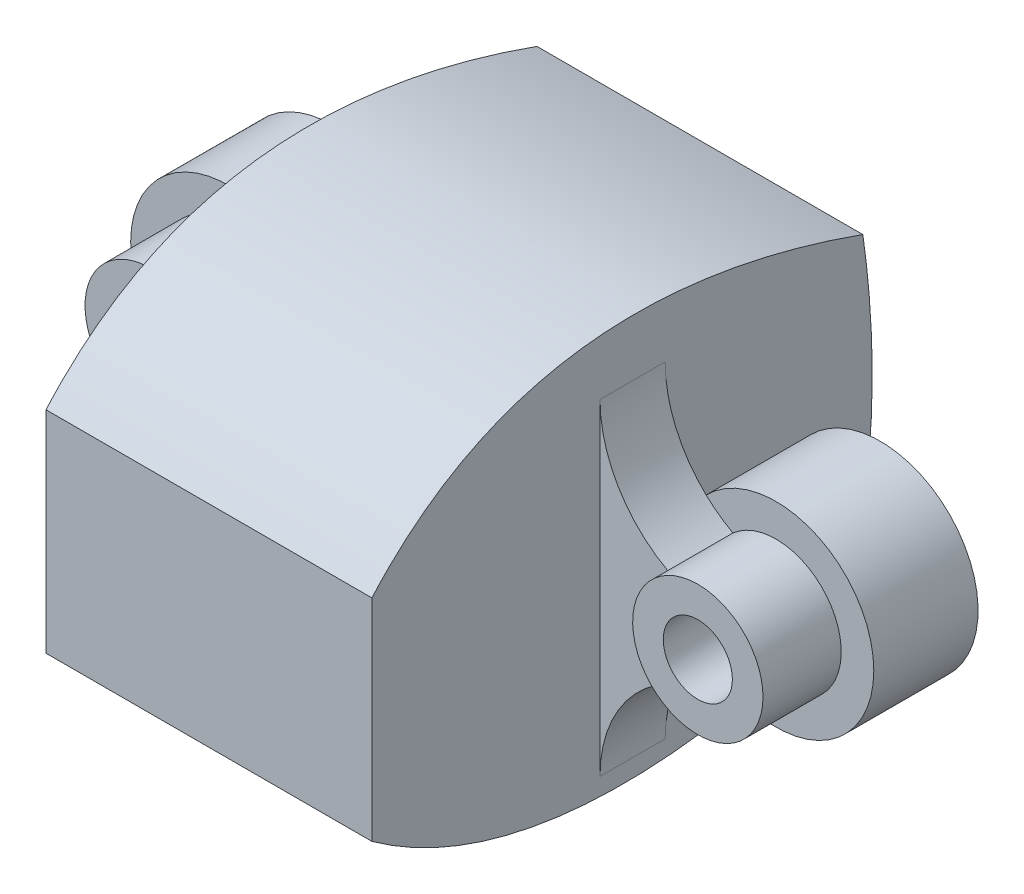
from build123d import *

# Parameters (mm, degrees)
BOSS_EXTRUDE1_DEPTH = 12.5
SKETCH3_W           = 5
SKETCH3_H           = 7.5
BOSS_EXTRUDE2_DEPTH = 27.5
SKETCH4_R           = 7.5
BOSS_EXTRUDE3_DEPTH = 8
SKETCH5_W           = 10.105162594
SKETCH5_H           = 17.406531809
CUT_EXTRUDE1_DEPTH  = 151.624338723
SKETCH6_R           = 5
BOSS_EXTRUDE4_DEPTH = 6
FILLET1_R           = 10
SKETCH7_R           = 2.65
CUT_EXTRUDE2_DEPTH  = 6


with BuildPart() as part:
    # Sketch1 → Boss-Extrude1 (new, symmetric)
    with BuildSketch(Plane(origin=(0, 0, 0), x_dir=(0, 0, -1), z_dir=(1, 0, 0))):
        with BuildLine():
            Line((-19.096184677, 121.225789304), (-19.096184677, 137.404518888))
            add(Edge.make_bspline(
                [(-19.096184677, 137.404518888), (-6.467464955, 151.699126132), (18.56858261, 142.711827006)],
                knots=[0, 0, 0, 1, 1, 1], degree=2))
            add(Edge.make_bspline(
                [(18.56858261, 142.711827006), (20.515458249, 129.056565793), (17.198954708, 118.572135245)],
                knots=[0, 0, 0, 1, 1, 1], degree=2))
            add(Edge.make_bspline(
                [(17.198954708, 118.572135245), (7.355214534, 114.934231268), (-7.542469836, 112.881439696), (-19.096184677, 121.225789304)],
                knots=[0, 0, 0, 0, 1, 1, 1, 1], degree=3))
        make_face()
    extrude(amount=BOSS_EXTRUDE1_DEPTH, both=True)

    # Sketch3 → Boss-Extrude2 (add, symmetric)
    with BuildSketch(Plane(origin=(0, 0, 0), x_dir=(0, 0, -1), z_dir=(1, 0, 0))):
        with Locations((0.903815323, 129.315154096)):
            Rectangle(SKETCH3_W, SKETCH3_H)
    extrude(amount=BOSS_EXTRUDE2_DEPTH, both=True)

    # Sketch4 → Boss-Extrude3 (add)
    with BuildSketch(Plane(origin=(0, 0, -3.403815323), x_dir=(-1, 0, 0), z_dir=(0, 0, -1))):
        with Locations(Location((-21.004809472, 129.315154096, 0), (0, 0, 210))):
            Circle(SKETCH4_R)
        with Locations(Location((21.004809472, 129.315154096, 0), (0, 0, 210))):
            Circle(SKETCH4_R)
    extrude(amount=BOSS_EXTRUDE3_DEPTH)

    # Sketch5 → Cut-Extrude1 (cut, through all)
    with BuildSketch(Plane.XY.offset(-3.403815323)):
        with Locations((-26.057390769, 128.111888192)):
            Rectangle(SKETCH5_W, SKETCH5_H)
        with Locations((26.057390769, 128.111888192)):
            Rectangle(SKETCH5_W, SKETCH5_H)
    extrude(amount=CUT_EXTRUDE1_DEPTH, mode=Mode.SUBTRACT)

    # Sketch6 → Boss-Extrude4 (add)
    with BuildSketch(Plane.XY.offset(-3.403815323)):
        with Locations(Location((21.004809472, 129.315154096, 0), (0, 0, 228.590377891))):
            Circle(SKETCH6_R)
        with Locations(Location((-21.004809472, 129.315154096, 0), (0, 0, 48.590377891))):
            Circle(SKETCH6_R)
    extrude(amount=BOSS_EXTRUDE4_DEPTH)

    # Fillet1
    # the kernel refuses this fillet: 10 mm, written as the material it adds along each edge
    with BuildSketch(Plane(origin=(12.5, 125.565154096, 1.596184677), x_dir=(0, -1, 0), z_dir=(0, 0, -1)), Plane(origin=(12.5, 133.065154096, -3.403815323), x_dir=(0, 1, 0), z_dir=(0, 0, 1))) as fillet1_piece_1:
        with BuildLine():
            CenterArc((8.771382419, -10), FILLET1_R, 90, 61.299054853)
            Line((0, -5.197620333), (0, 0))
            Line((0, 0), (8.771382419, 0))
        make_face()
    extrude(amount=5)
    with BuildSketch(Plane(origin=(-12.5, 133.065154096, -3.403815323), x_dir=(0, 1, 0), z_dir=(0, 0, 1)), Plane(origin=(-12.5, 125.565154096, 1.596184677), x_dir=(0, -1, 0), z_dir=(0, 0, -1))) as fillet1_piece_2:
        with BuildLine():
            CenterArc((8.771382419, 10), FILLET1_R, 208.700945147, 61.299054853)
            Line((0, 5.197620333), (0, 0))
            Line((0, 0), (8.771382419, 0))
        make_face()
    extrude(amount=5)

    # Sketch7 → Cut-Extrude2 (cut)
    with BuildSketch(Plane.XY.offset(2.596184677)):
        with Locations((21.004809472, 129.315154096)):
            Circle(SKETCH7_R)
        with Locations((-21.004809472, 129.315154096)):
            Circle(SKETCH7_R)
    extrude(amount=-CUT_EXTRUDE2_DEPTH, mode=Mode.SUBTRACT)


with BuildPart() as part_1:
    # Body-Move/Copy1: moved
    add(part.part.moved(Location((0, -129.32, -0.9))))


solid = part_1.part
